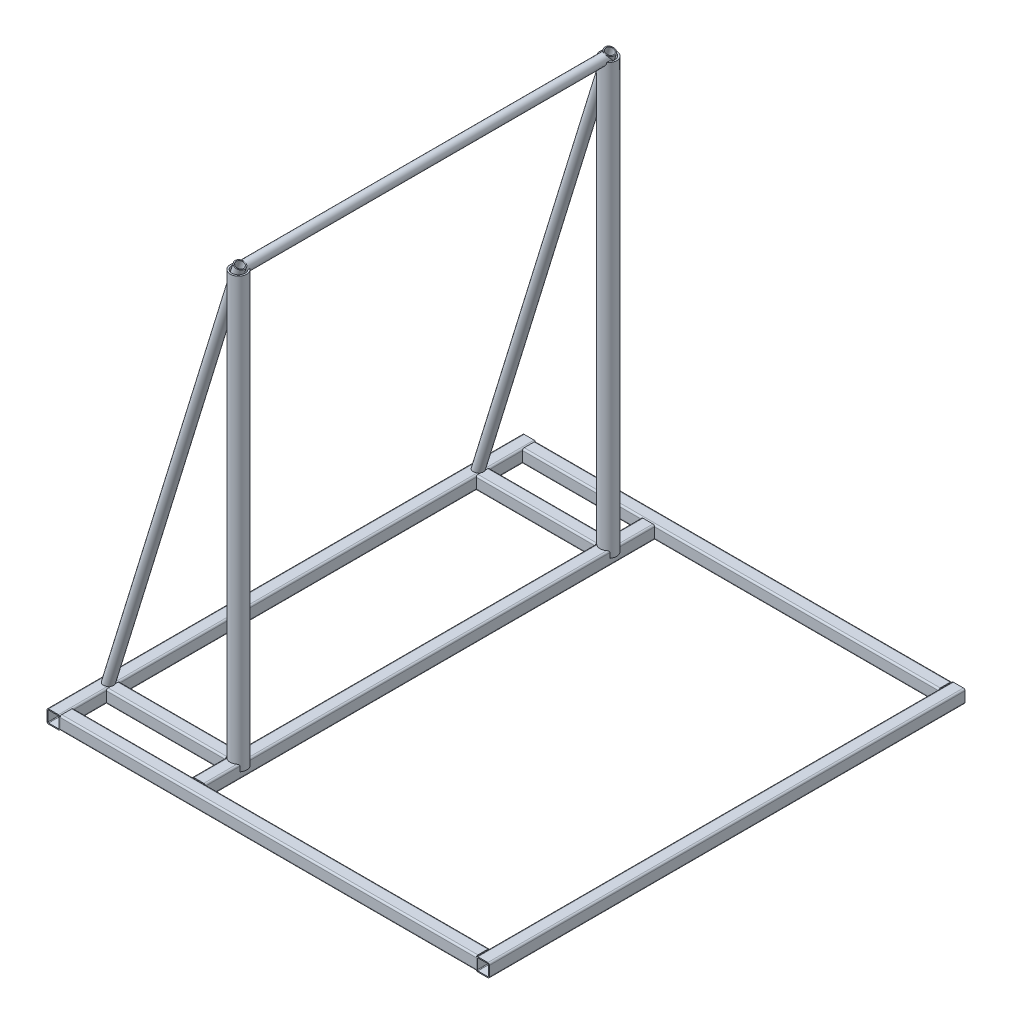
from build123d import *

# Parameters (mm, degrees)
RECTANGULAR_TUBE_CONFIGURED_4_X_3_X_0_DEPTH      = 1420
RECTANGULAR_TUBE_CONFIGURED_4_X_3_X_0_DEPTH_BACK = 20
RECTANGULAR_TUBE_CONFIGURED_4_X_3_2_DEPTH        = 1440
RECTANGULAR_TUBE_CONFIGURED_4_X_3_3_DEPTH        = 1302
RECTANGULAR_TUBE_CONFIGURED_4_X_3_5_DEPTH        = 1302
RECTANGULAR_TUBE_CONFIGURED_4_X_3_7_DEPTH        = 1402
RECTANGULAR_TUBE_CONFIGURED_4_X_3_9_DEPTH        = 402
RECTANGULAR_TUBE_CONFIGURED_4_X_3_11_DEPTH       = 402
SKETCH11_R                                       = 25
SKETCH11_R_2                                     = 20
PIPE_CONFIGURED_1_0_SCH_40_1_DEPTH               = 1300
SKETCH11_ON_SEGMENT_2_R                          = 25
SKETCH11_ON_SEGMENT_2_R_2                        = 20
PIPE_CONFIGURED_1_0_SCH_40_1_2_DEPTH             = 1300
PIPE_START                                       = -191.155802
PIPE_CONFIGURED_1_0_SCH_40_2_OUTLINE_R           = 15
PIPE_CONFIGURED_1_0_SCH_40_2_OUTLINE_R_2         = 12
PIPE_CONFIGURED_1_0_SCH_40_2_DEPTH               = 1375.147051
PIPE_START_2                                     = -560
PIPE_CONFIGURED_1_0_SCH_40_2_2_OUTLINE_R         = 15
PIPE_CONFIGURED_1_0_SCH_40_2_2_OUTLINE_R_2       = 12
PIPE_CONFIGURED_1_0_SCH_40_2_2_DEPTH             = 1120
PIPE_START_3                                     = 1153
PIPE_CONFIGURED_1_0_SCH_40_2_3_DEPTH             = 32
PIPE_CONFIGURED_1_0_SCH_40_2_4_OUTLINE_R         = 15
PIPE_CONFIGURED_1_0_SCH_40_2_4_OUTLINE_R_2       = 12
PIPE_CONFIGURED_1_0_SCH_40_2_4_DEPTH             = 1375.147051


with BuildPart() as part:
    # Sketch1 → Rectangular tube - configured 4 X 3 X 0.25(1) (new, two sides: drawn at the far end of the back side and taken through both)
    with BuildSketch(Plane(origin=(-650, 0, 700), x_dir=(1, 0, 0), z_dir=(0, 0, -1)).offset(-RECTANGULAR_TUBE_CONFIGURED_4_X_3_X_0_DEPTH_BACK)):
        with BuildLine():
            Line((-15, -20), (15, -20))
            ThreePointArc((15, -20), (18.535534, -18.535534), (20, -15))
            Line((20, -15), (20, 15))
            ThreePointArc((20, 15), (18.535534, 18.535534), (15, 20))
            Line((15, 20), (-15, 20))
            ThreePointArc((-15, 20), (-18.535534, 18.535534), (-20, 15))
            Line((-20, 15), (-20, -15))
            ThreePointArc((-20, -15), (-18.535534, -18.535534), (-15, -20))
        make_face()
        with BuildLine():
            Line((-15, -17), (15, -17))
            ThreePointArc((15, -17), (16.414214, -16.414214), (17, -15))
            Line((17, -15), (17, 15))
            ThreePointArc((17, 15), (16.414214, 16.414214), (15, 17))
            Line((15, 17), (-15, 17))
            ThreePointArc((-15, 17), (-16.414214, 16.414214), (-17, 15))
            Line((-17, 15), (-17, -15))
            ThreePointArc((-17, -15), (-16.414214, -16.414214), (-15, -17))
        make_face(mode=Mode.SUBTRACT)
    extrude(amount=RECTANGULAR_TUBE_CONFIGURED_4_X_3_X_0_DEPTH + RECTANGULAR_TUBE_CONFIGURED_4_X_3_X_0_DEPTH_BACK)


with BuildPart() as body_2:
    # Sketch1 on segment 2 (carried to segment 2) → Rectangular tube - configured 4 X 3  2 (new body)
    with BuildSketch(Plane(origin=(650, 0, 720), x_dir=(1, 0, 0), z_dir=(0, 0, -1))):
        with BuildLine():
            Line((-15, -20), (15, -20))
            ThreePointArc((15, -20), (18.535534, -18.535534), (20, -15))
            Line((20, -15), (20, 15))
            ThreePointArc((20, 15), (18.535534, 18.535534), (15, 20))
            Line((15, 20), (-15, 20))
            ThreePointArc((-15, 20), (-18.535534, 18.535534), (-20, 15))
            Line((-20, 15), (-20, -15))
            ThreePointArc((-20, -15), (-18.535534, -18.535534), (-15, -20))
        make_face()
        with BuildLine():
            Line((-15, -17), (15, -17))
            ThreePointArc((15, -17), (16.414214, -16.414214), (17, -15))
            Line((17, -15), (17, 15))
            ThreePointArc((17, 15), (16.414214, 16.414214), (15, 17))
            Line((15, 17), (-15, 17))
            ThreePointArc((-15, 17), (-16.414214, 16.414214), (-17, 15))
            Line((-17, 15), (-17, -15))
            ThreePointArc((-17, -15), (-16.414214, -16.414214), (-15, -17))
        make_face(mode=Mode.SUBTRACT)
    extrude(amount=RECTANGULAR_TUBE_CONFIGURED_4_X_3_2_DEPTH)


with BuildPart() as body_3:
    # Sketch1 on segment 3 (carried to segment 3) → Rectangular tube - configured 4 X 3  3 (new body)
    with BuildSketch(Plane(origin=(651, 0, 700), x_dir=(0, 0, -1), z_dir=(-1, 0, 0))):
        with BuildLine():
            Line((-15, -20), (15, -20))
            ThreePointArc((15, -20), (18.535534, -18.535534), (20, -15))
            Line((20, -15), (20, 15))
            ThreePointArc((20, 15), (18.535534, 18.535534), (15, 20))
            Line((15, 20), (-15, 20))
            ThreePointArc((-15, 20), (-18.535534, 18.535534), (-20, 15))
            Line((-20, 15), (-20, -15))
            ThreePointArc((-20, -15), (-18.535534, -18.535534), (-15, -20))
        make_face()
        with BuildLine():
            Line((-15, -17), (15, -17))
            ThreePointArc((15, -17), (16.414214, -16.414214), (17, -15))
            Line((17, -15), (17, 15))
            ThreePointArc((17, 15), (16.414214, 16.414214), (15, 17))
            Line((15, 17), (-15, 17))
            ThreePointArc((-15, 17), (-16.414214, 16.414214), (-17, 15))
            Line((-17, 15), (-17, -15))
            ThreePointArc((-17, -15), (-16.414214, -16.414214), (-15, -17))
        make_face(mode=Mode.SUBTRACT)
    extrude(amount=RECTANGULAR_TUBE_CONFIGURED_4_X_3_3_DEPTH)

    # Rectangular tube - configured 4 X 3 3 en
    split(bisect_by=Plane(origin=(630, 0, 700), x_dir=(0, -1, 0), z_dir=(-1, 0, 0)), keep=Keep.TOP)

    # Rectangular tube - configured 4 X 3  4
    split(bisect_by=Plane(origin=(-630, 0, 700), x_dir=(0, 1, 0), z_dir=(1, 0, 0)), keep=Keep.TOP)


with BuildPart() as body_4:
    # Sketch1 on segment 4 (carried to segment 4) → Rectangular tube - configured 4 X 3  5 (new body)
    with BuildSketch(Plane(origin=(651, 0, -700), x_dir=(0, 0, -1), z_dir=(-1, 0, 0))):
        with BuildLine():
            Line((-15, -20), (15, -20))
            ThreePointArc((15, -20), (18.535534, -18.535534), (20, -15))
            Line((20, -15), (20, 15))
            ThreePointArc((20, 15), (18.535534, 18.535534), (15, 20))
            Line((15, 20), (-15, 20))
            ThreePointArc((-15, 20), (-18.535534, 18.535534), (-20, 15))
            Line((-20, 15), (-20, -15))
            ThreePointArc((-20, -15), (-18.535534, -18.535534), (-15, -20))
        make_face()
        with BuildLine():
            Line((-15, -17), (15, -17))
            ThreePointArc((15, -17), (16.414214, -16.414214), (17, -15))
            Line((17, -15), (17, 15))
            ThreePointArc((17, 15), (16.414214, 16.414214), (15, 17))
            Line((15, 17), (-15, 17))
            ThreePointArc((-15, 17), (-16.414214, 16.414214), (-17, 15))
            Line((-17, 15), (-17, -15))
            ThreePointArc((-17, -15), (-16.414214, -16.414214), (-15, -17))
        make_face(mode=Mode.SUBTRACT)
    extrude(amount=RECTANGULAR_TUBE_CONFIGURED_4_X_3_5_DEPTH)

    # Rectangular tube - configured 4 X 3 5 en
    split(bisect_by=Plane(origin=(630, 0, -700), x_dir=(0, -1, 0), z_dir=(-1, 0, 0)), keep=Keep.TOP)

    # Rectangular tube - configured 4 X 3  6
    split(bisect_by=Plane(origin=(-630, 0, -700), x_dir=(0, 1, 0), z_dir=(1, 0, 0)), keep=Keep.TOP)


with BuildPart() as body_5:
    # Sketch1 on segment 5 (carried to segment 5) → Rectangular tube - configured 4 X 3  7 (new body)
    with BuildSketch(Plane(origin=(-250, 0, 701), x_dir=(1, 0, 0), z_dir=(0, 0, -1))):
        with BuildLine():
            Line((-15, -20), (15, -20))
            ThreePointArc((15, -20), (18.535534, -18.535534), (20, -15))
            Line((20, -15), (20, 15))
            ThreePointArc((20, 15), (18.535534, 18.535534), (15, 20))
            Line((15, 20), (-15, 20))
            ThreePointArc((-15, 20), (-18.535534, 18.535534), (-20, 15))
            Line((-20, 15), (-20, -15))
            ThreePointArc((-20, -15), (-18.535534, -18.535534), (-15, -20))
        make_face()
        with BuildLine():
            Line((-15, -17), (15, -17))
            ThreePointArc((15, -17), (16.414214, -16.414214), (17, -15))
            Line((17, -15), (17, 15))
            ThreePointArc((17, 15), (16.414214, 16.414214), (15, 17))
            Line((15, 17), (-15, 17))
            ThreePointArc((-15, 17), (-16.414214, 16.414214), (-17, 15))
            Line((-17, 15), (-17, -15))
            ThreePointArc((-17, -15), (-16.414214, -16.414214), (-15, -17))
        make_face(mode=Mode.SUBTRACT)
    extrude(amount=RECTANGULAR_TUBE_CONFIGURED_4_X_3_7_DEPTH)

    # Rectangular tube - configured 4 X 3 7 en
    split(bisect_by=Plane(origin=(-250, 0, -680), x_dir=(0, -1, 0), z_dir=(0, 0, 1)), keep=Keep.TOP)

    # Rectangular tube - configured 4 X 3  8
    split(bisect_by=Plane(origin=(-250, 0, 680), x_dir=(0, 1, 0), z_dir=(0, 0, -1)), keep=Keep.TOP)


with BuildPart() as body_6:
    # Sketch1 on segment 6 (carried to segment 6) → Rectangular tube - configured 4 X 3  9 (new body)
    with BuildSketch(Plane(origin=(-249, 0, 560), x_dir=(0, 0, -1), z_dir=(-1, 0, 0))):
        with BuildLine():
            Line((-15, -20), (15, -20))
            ThreePointArc((15, -20), (18.535534, -18.535534), (20, -15))
            Line((20, -15), (20, 15))
            ThreePointArc((20, 15), (18.535534, 18.535534), (15, 20))
            Line((15, 20), (-15, 20))
            ThreePointArc((-15, 20), (-18.535534, 18.535534), (-20, 15))
            Line((-20, 15), (-20, -15))
            ThreePointArc((-20, -15), (-18.535534, -18.535534), (-15, -20))
        make_face()
        with BuildLine():
            Line((-15, -17), (15, -17))
            ThreePointArc((15, -17), (16.414214, -16.414214), (17, -15))
            Line((17, -15), (17, 15))
            ThreePointArc((17, 15), (16.414214, 16.414214), (15, 17))
            Line((15, 17), (-15, 17))
            ThreePointArc((-15, 17), (-16.414214, 16.414214), (-17, 15))
            Line((-17, 15), (-17, -15))
            ThreePointArc((-17, -15), (-16.414214, -16.414214), (-15, -17))
        make_face(mode=Mode.SUBTRACT)
    extrude(amount=RECTANGULAR_TUBE_CONFIGURED_4_X_3_9_DEPTH)

    # Rectangular tube - configured 4 X 3 9 en
    split(bisect_by=Plane(origin=(-270, 0, 560), x_dir=(0, -1, 0), z_dir=(-1, 0, 0)), keep=Keep.TOP)

    # Rectangular tube - configured 4 X 3  10
    split(bisect_by=Plane(origin=(-630, 0, 560), x_dir=(0, 1, 0), z_dir=(1, 0, 0)), keep=Keep.TOP)


with BuildPart() as body_7:
    # Sketch1 on segment 7 (carried to segment 7) → Rectangular tube - configured 4 X 3  11 (new body)
    with BuildSketch(Plane(origin=(-249, 0, -560), x_dir=(0, 0, -1), z_dir=(-1, 0, 0))):
        with BuildLine():
            Line((-15, -20), (15, -20))
            ThreePointArc((15, -20), (18.535534, -18.535534), (20, -15))
            Line((20, -15), (20, 15))
            ThreePointArc((20, 15), (18.535534, 18.535534), (15, 20))
            Line((15, 20), (-15, 20))
            ThreePointArc((-15, 20), (-18.535534, 18.535534), (-20, 15))
            Line((-20, 15), (-20, -15))
            ThreePointArc((-20, -15), (-18.535534, -18.535534), (-15, -20))
        make_face()
        with BuildLine():
            Line((-15, -17), (15, -17))
            ThreePointArc((15, -17), (16.414214, -16.414214), (17, -15))
            Line((17, -15), (17, 15))
            ThreePointArc((17, 15), (16.414214, 16.414214), (15, 17))
            Line((15, 17), (-15, 17))
            ThreePointArc((-15, 17), (-16.414214, 16.414214), (-17, 15))
            Line((-17, 15), (-17, -15))
            ThreePointArc((-17, -15), (-16.414214, -16.414214), (-15, -17))
        make_face(mode=Mode.SUBTRACT)
    extrude(amount=RECTANGULAR_TUBE_CONFIGURED_4_X_3_11_DEPTH)

    # Rectangular tube - configured 4 X 3 11 e
    split(bisect_by=Plane(origin=(-270, 0, -560), x_dir=(0, -1, 0), z_dir=(-1, 0, 0)), keep=Keep.TOP)

    # Rectangular tube - configured 4 X 3  12
    split(bisect_by=Plane(origin=(-630, 0, -560), x_dir=(0, 1, 0), z_dir=(1, 0, 0)), keep=Keep.TOP)


with BuildPart() as body_8:
    # Sketch11 → Pipe - configured 1.0 SCH 40(1) (new body)
    with BuildSketch(Plane(origin=(-250, 0, 560), x_dir=(1, 0, 0), z_dir=(0, 1, 0))):
        Circle(SKETCH11_R)
        Circle(SKETCH11_R_2, mode=Mode.SUBTRACT)
    extrude(amount=PIPE_CONFIGURED_1_0_SCH_40_1_DEPTH)


with BuildPart() as body_9:
    # Sketch11 on segment 2 (carried to segment 2) → Pipe - configured 1.0 SCH 40_1 2 (new body)
    with BuildSketch(Plane(origin=(-250, 0, -560), x_dir=(1, 0, 0), z_dir=(0, 1, 0))):
        Circle(SKETCH11_ON_SEGMENT_2_R)
        Circle(SKETCH11_ON_SEGMENT_2_R_2, mode=Mode.SUBTRACT)
    extrude(amount=PIPE_CONFIGURED_1_0_SCH_40_1_2_DEPTH)


with BuildPart() as body_10:
    # Pipe - configured 1.0 SCH 40(2): read off the stored shape, not the designer's step
    # Pipe - configured 1.0 SCH 40(2) outline → Pipe - configured 1.0 SCH 40(2) (new body)
    with BuildSketch(Plane(origin=(0, 0, 0), x_dir=(0.9557790087219493, -0.29408584883752575, 0), z_dir=(0.29408584883752575, 0.9557790087219493, 0)).offset(PIPE_START)):
        with Locations((-621.256356, 560)):
            Circle(PIPE_CONFIGURED_1_0_SCH_40_2_OUTLINE_R)
        with Locations((-621.256356, 560)):
            Circle(PIPE_CONFIGURED_1_0_SCH_40_2_OUTLINE_R_2, mode=Mode.SUBTRACT)
    extrude(amount=PIPE_CONFIGURED_1_0_SCH_40_2_DEPTH)


with BuildPart() as body_11:
    # Pipe - configured 1.0 SCH 40_2 2 outline → Pipe - configured 1.0 SCH 40_2 2 (new body)
    with BuildSketch(Plane.XY.offset(PIPE_START_2)):
        with Locations((-250, 1300)):
            Circle(PIPE_CONFIGURED_1_0_SCH_40_2_2_OUTLINE_R)
        with Locations((-250, 1300)):
            Circle(PIPE_CONFIGURED_1_0_SCH_40_2_2_OUTLINE_R_2, mode=Mode.SUBTRACT)
    extrude(amount=PIPE_CONFIGURED_1_0_SCH_40_2_2_DEPTH)

    # Pipe - configured 1.0 SCH 40_2 3 outline → Pipe - configured 1.0 SCH 40_2 3 (cut)
    with BuildSketch(Plane(origin=(0, 0, 0), x_dir=(0.9557790087219492, -0.2940858488375261, 0), z_dir=(0.29408584883752603, 0.9557790087219492, 0)).offset(PIPE_START_3)):
        with BuildLine():
            Line((-636.256356, -560), (-606.256356, -560))
            ThreePointArc((-606.256356, -560), (-621.256356, -545), (-636.256356, -560))
        make_face()
        with BuildLine():
            Line((-606.256356, 560), (-636.256356, 560))
            ThreePointArc((-636.256356, 560), (-621.256356, 545), (-606.256356, 560))
        make_face()
    extrude(amount=PIPE_CONFIGURED_1_0_SCH_40_2_3_DEPTH, mode=Mode.SUBTRACT)


with BuildPart() as body_12:
    # Pipe - configured 1.0 SCH 40_2 4 outline → Pipe - configured 1.0 SCH 40_2 4 (new body)
    with BuildSketch(Plane(origin=(0, 0, 0), x_dir=(0.9557790087219492, -0.2940858488375261, 0), z_dir=(0.29408584883752603, 0.9557790087219492, 0)).offset(PIPE_START)):
        with Locations((-621.256356, -560)):
            Circle(PIPE_CONFIGURED_1_0_SCH_40_2_4_OUTLINE_R)
        with Locations((-621.256356, -560)):
            Circle(PIPE_CONFIGURED_1_0_SCH_40_2_4_OUTLINE_R_2, mode=Mode.SUBTRACT)
    extrude(amount=PIPE_CONFIGURED_1_0_SCH_40_2_4_DEPTH)


solid = Compound([part.part, body_2.part, body_3.part, body_4.part, body_5.part, body_6.part, body_7.part, body_8.part, body_9.part, body_10.part, body_11.part, body_12.part])
